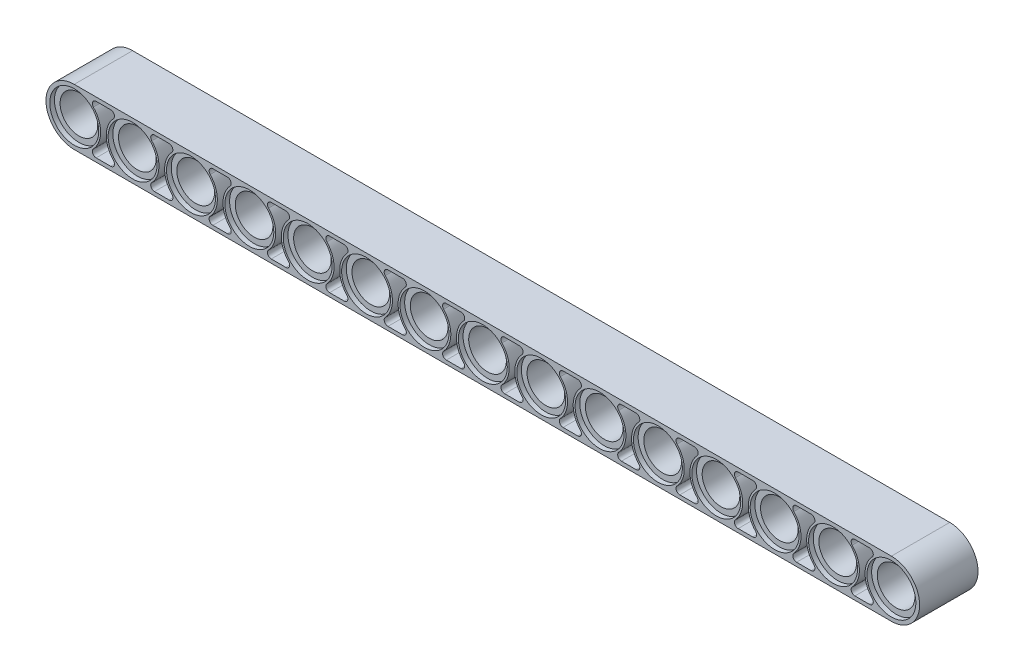
from build123d import *

# Parameters (mm, degrees)
SKETCH1_R           = 2.54
BOSS_EXTRUDE1_DEPTH = 3.937
SKETCH1_7_R         = 2.54
BOSS_EXTRUDE2_DEPTH = 3.937
SKETCH2_R           = 3.302
CUT_EXTRUDE1_DEPTH  = 0.635
LPATTERN1_COUNT     = 13
LPATTERN1_PITCH     = 7.874


with BuildPart() as part:
    # Sketch1 → Boss-Extrude1 (new body)
    with BuildSketch(Plane.XY):
        with BuildLine():
            Line((3.937, -3.81), (7.874, -3.81))
            ThreePointArc((7.874, -3.81), (11.684, 0), (7.874, 3.81))
            Line((7.874, 3.81), (3.937, 3.81))
            Line((3.937, 3.81), (3.937, 3.302))
            Line((3.937, 3.302), (4.92278669, 3.302))
            ThreePointArc((4.92278669, 3.302), (5.389414486, 2.994804631), (5.291688354, 2.44475))
            ThreePointArc((5.291688354, 2.44475), (4.318, 0), (5.291688354, -2.44475))
            ThreePointArc((5.291688354, -2.44475), (5.389414486, -2.994804631), (4.92278669, -3.302))
            Line((4.92278669, -3.302), (3.937, -3.302))
            Line((3.937, -3.302), (3.937, -3.81))
        make_face()
        with Locations((7.874, 0)):
            Circle(SKETCH1_R, mode=Mode.SUBTRACT)
    extrude(amount=BOSS_EXTRUDE1_DEPTH)


with BuildPart() as body_2:
    # Sketch1<7> → Boss-Extrude2 (new body)
    with BuildSketch(Plane.XY):
        with BuildLine():
            Line((3.937, -3.81), (3.937, -3.302))
            Line((3.937, -3.302), (2.95121331, -3.302))
            ThreePointArc((2.95121331, -3.302), (2.484585514, -2.994804631), (2.582311646, -2.44475))
            ThreePointArc((2.582311646, -2.44475), (3.556, 0), (2.582311646, 2.44475))
            ThreePointArc((2.582311646, 2.44475), (2.484585514, 2.994804631), (2.95121331, 3.302))
            Line((2.95121331, 3.302), (3.937, 3.302))
            Line((3.937, 3.302), (3.937, 3.81))
            Line((3.937, 3.81), (-3.937, 3.81))
            Line((-3.937, 3.81), (-3.937, 3.302))
            Line((-3.937, 3.302), (-2.95121331, 3.302))
            ThreePointArc((-2.95121331, 3.302), (-2.484585514, 2.994804631), (-2.582311646, 2.44475))
            ThreePointArc((-2.582311646, 2.44475), (-3.556, 0), (-2.582311646, -2.44475))
            ThreePointArc((-2.582311646, -2.44475), (-2.484585514, -2.994804631), (-2.95121331, -3.302))
            Line((-2.95121331, -3.302), (-3.937, -3.302))
            Line((-3.937, -3.302), (-3.937, -3.81))
            Line((-3.937, -3.81), (3.937, -3.81))
        make_face()
        Circle(SKETCH1_7_R, mode=Mode.SUBTRACT)
    boss_extrude2 = extrude(amount=BOSS_EXTRUDE2_DEPTH)


with BuildPart() as cut_extrude1_tool:
    # Sketch2 → Cut-Extrude1 (new body)
    with BuildSketch(Plane.XY):
        with Locations((7.874, 0)):
            Circle(SKETCH2_R)
        Circle(SKETCH2_R)
    cut_extrude1 = extrude(amount=CUT_EXTRUDE1_DEPTH)


with BuildPart() as part_1:
    add(part.part)

    # Cut-Extrude1: cut by cut_extrude1_tool
    add(cut_extrude1_tool.part, mode=Mode.SUBTRACT)


with BuildPart() as body_2_1:
    add(body_2.part)

    # Cut-Extrude1: cut by cut_extrude1_tool
    add(cut_extrude1_tool.part, mode=Mode.SUBTRACT)

    # LPattern1: Boss-Extrude2, Cut-Extrude1 ×13
    with Locations(*[(-i * LPATTERN1_PITCH, 0, 0) for i in range(1, LPATTERN1_COUNT)]):
        add(boss_extrude2)
        add(cut_extrude1, mode=Mode.SUBTRACT)


with BuildPart() as body_3:
    # Mirror2: mirrored copy
    add(part_1.part.mirror(Plane(origin=(-47.244, 0, 0), x_dir=(0, 0, 1), z_dir=(1, 0, 0))))


with BuildPart() as part_2:
    add(part_1.part)

    # Combine1: union body 3, body 2
    add(body_3.part)
    add(body_2_1.part)

    # Mirror3: part across plane


with BuildPart() as part_3:
    add(part_2.part)
    add(part_2.part.mirror(Plane.XY.offset(3.937)))


solid = part_3.part
